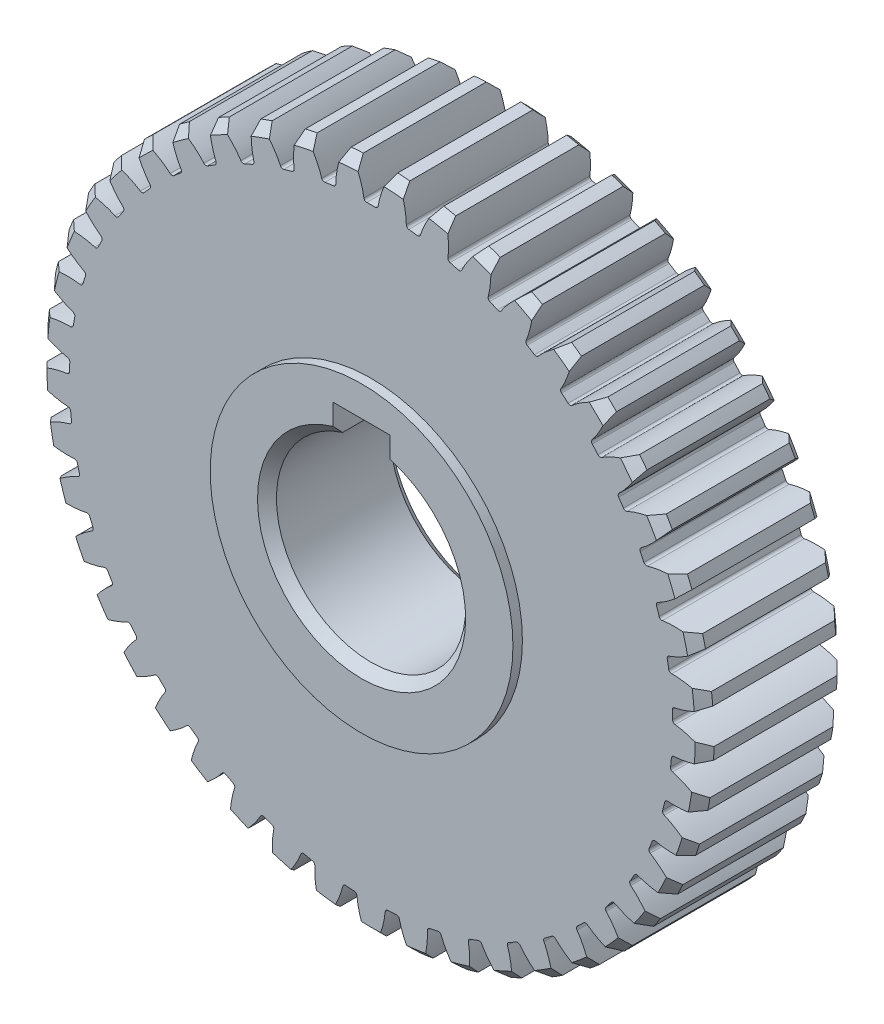
from build123d import *

# Parameters (mm, degrees)
SKETCH_1140_R                    = 35.25
EXTRUDE_1166_DEPTH               = 7.5
CHAMFER_1205_SIZE                = 1
CUT_EXTRUDE_1601_DEPTH           = 7.5
FILLET_1_R                       = 0.3
PATTERN_CIRCULAR_1_COUNT         = 45
FILLET_1_OF_PATTERN_CIRCULAR_1_R = 0.3
SKETCH_1_R                       = 16
EXTRUDE_1_DEPTH                  = 1
CUT_EXTRUDE_1_DEPTH              = 53.352443413
CUT_EXTRUDE_1_DEPTH_BACK         = 2
SKETCH_2_R                       = 20
CUT_EXTRUDE_2_DEPTH              = 52.776233267
CHAMFER_1_SIZE                   = 1


with BuildPart() as part:
    # Sketch 1140 → Extrude 1166 (new, symmetric)
    with BuildSketch(Plane.XY):
        Circle(SKETCH_1140_R)
    extrude(amount=EXTRUDE_1166_DEPTH, both=True)

    # Chamfer 1205
    chamfer_1205_edges = [part.edges().sort_by_distance(p)[0] for p in [
        (-35.25, 0, -7.5),
        (-35.25, 0, 7.5),
    ]]
    chamfer(chamfer_1205_edges, length=CHAMFER_1205_SIZE)

    # Sketch 1286 → Cut-Extrude 1601 (cut, symmetric)
    with BuildSketch(Plane.XY):
        with BuildLine():
            ThreePointArc((-0.720202236, 31.866862628), (0, 31.875), (0.720202236, 31.866862628))
            add(Edge.make_bspline(
                [(0.720202236, 31.866862628), (0.721846783, 31.886965772), (0.729139044, 31.967087408), (0.754197847, 32.166699349), (0.808491142, 32.471975556), (0.900082767, 32.860091396), (1.055369093, 33.394053741), (1.251768326, 33.949265814), (1.470916688, 34.47875715), (1.667406467, 34.899169702), (1.776559915, 35.119972584), (1.818474707, 35.203063073)],
                knots=[0.000932193, 0.000932193, 0.000932193, 0.000932193, 0.000932193, 0.001401017, 0.002802034, 0.005604068, 0.008132613, 0.010661158, 0.015718248, 0.019278665, 0.021441016, 0.021441016, 0.021441016, 0.021441016, 0.021441016], degree=4))
            ThreePointArc((1.818474707, 35.203063073), (0, 35.25), (-1.818474707, 35.203063073))
            add(Edge.make_bspline(
                [(-0.720202236, 31.866862628), (-0.721846783, 31.886965772), (-0.729139044, 31.967087408), (-0.754197847, 32.166699349), (-0.808491142, 32.471975556), (-0.900082767, 32.860091396), (-1.055369093, 33.394053741), (-1.251768326, 33.949265814), (-1.470916688, 34.47875715), (-1.667406467, 34.899169702), (-1.776559915, 35.119972584), (-1.818474707, 35.203063073)],
                knots=[0.000932193, 0.000932193, 0.000932193, 0.000932193, 0.000932193, 0.001401017, 0.002802034, 0.005604068, 0.008132613, 0.010661158, 0.015718248, 0.019278665, 0.021441016, 0.021441016, 0.021441016, 0.021441016, 0.021441016], degree=4))
        make_face()
    cut_extrude_1601 = extrude(amount=CUT_EXTRUDE_1601_DEPTH, both=True, mode=Mode.SUBTRACT)

    # 圆角1
    fillet_1_edges = [part.edges().sort_by_distance(p)[0] for p in [
        (0.720202236, 31.866862628, -3.75),
        (-0.720202236, 31.866862628, -3.75),
    ]]
    fillet(fillet_1_edges, radius=FILLET_1_R)

    # 圆周阵列1: Cut-Extrude 1601 ×45 about axis
    pattern_circular_1_axis = Axis((0, 0, 7.5), (0, 0, -1))
    for i in range(1, PATTERN_CIRCULAR_1_COUNT):
        add(cut_extrude_1601.rotate(pattern_circular_1_axis, i * 360 / PATTERN_CIRCULAR_1_COUNT), mode=Mode.SUBTRACT)

    # 圆角1 of 圆周阵列1
    fillet_1_of_pattern_circular_1_edges = [part.edges().sort_by_distance(p)[0] for p in [
        (5.148203367, 31.456503733, -3.75),
        (3.721816812, 31.65696929, -3.75),
        (9.476000576, 30.433879774, -3.75),
        (8.09139493, 30.830909054, -3.75),
        (13.619358212, 28.818894963, -3.75),
        (12.303483249, 29.404760243, -3.75),
        (17.497630533, 26.642983143, -3.75),
        (16.276098262, 27.406281221, -3.75),
        (21.035331378, 23.948495962, -3.75),
        (19.931917536, 24.87437011, -3.75),
        (24.163603425, 20.787878548, -3.75),
        (23.199784707, 21.858307678, -3.75),
        (26.821558418, 17.222648724, -3.75),
        (26.016094458, 18.416798151, -3.75),
        (28.957462284, 13.322199633, -3.75),
        (28.326030524, 14.616826597, -3.75),
        (30.529742086, 9.162449079, -3.75),
        (30.084632626, 10.532355139, -3.75),
        (31.507795186, 4.824361877, -3.75),
        (31.257671574, 6.242883369, -3.75),
        (31.872584892, 0.392373959, -3.75),
        (31.822315501, 1.831900976, -3.75),
        (31.617010987, -4.047251073, -3.75),
        (31.767574253, -2.614737286, -3.75),
        (30.746047927, -8.408100966, -3.75),
        (31.094513308, -7.010482662, -3.75),
        (29.276648018, -12.605296737, -3.75),
        (29.816233031, -11.269776966, -3.75),
        (27.237411456, -16.557144746, -3.75),
        (27.957613693, -15.309717881, -3.75),
        (24.668029663, -20.186726766, -3.75),
        (25.554831206, -19.051672552, -3.75),
        (21.618512732, -23.423397112, -3.75),
        (22.654652998, -22.422808088, -3.75),
        (18.148216041, -26.204157677, -3.75),
        (19.313527738, -25.35750917, -3.75),
        (14.324684968, -28.474884119, -3.75),
        (15.59648663, -27.79865518, -3.75),
        (10.222340196, -30.191379331, -3.75),
        (11.57587765, -29.698731987, -3.75),
        (5.9210292, -31.320233687, -3.75),
        (7.32995738, -31.020756758, -3.75),
        (1.504472106, -31.83947532, -3.75),
        (2.941367826, -31.738997784, -3.75),
        (-2.941367826, -31.738997784, -3.75),
        (-1.504472106, -31.83947532, -3.75),
        (-7.32995738, -31.020756758, -3.75),
        (-5.9210292, -31.320233687, -3.75),
        (-11.57587765, -29.698731987, -3.75),
        (-10.222340196, -30.191379331, -3.75),
        (-15.59648663, -27.79865518, -3.75),
        (-14.324684968, -28.474884119, -3.75),
        (-19.313527738, -25.35750917, -3.75),
        (-18.148216041, -26.204157677, -3.75),
        (-22.654652998, -22.422808088, -3.75),
        (-21.618512732, -23.423397112, -3.75),
        (-25.554831206, -19.051672552, -3.75),
        (-24.668029663, -20.186726766, -3.75),
        (-27.957613693, -15.309717881, -3.75),
        (-27.237411456, -16.557144746, -3.75),
        (-29.816233031, -11.269776966, -3.75),
        (-29.276648018, -12.605296737, -3.75),
        (-31.094513308, -7.010482662, -3.75),
        (-30.746047927, -8.408100966, -3.75),
        (-31.767574253, -2.614737286, -3.75),
        (-31.617010987, -4.047251073, -3.75),
        (-31.822315501, 1.831900976, -3.75),
        (-31.872584892, 0.392373959, -3.75),
        (-31.257671574, 6.242883369, -3.75),
        (-31.507795186, 4.824361877, -3.75),
        (-30.084632626, 10.532355139, -3.75),
        (-30.529742086, 9.162449079, -3.75),
        (-28.326030524, 14.616826597, -3.75),
        (-28.957462284, 13.322199633, -3.75),
        (-26.016094458, 18.416798151, -3.75),
        (-26.821558418, 17.222648724, -3.75),
        (-23.199784707, 21.858307678, -3.75),
        (-24.163603425, 20.787878548, -3.75),
        (-19.931917536, 24.87437011, -3.75),
        (-21.035331378, 23.948495962, -3.75),
        (-16.276098262, 27.406281221, -3.75),
        (-17.497630533, 26.642983143, -3.75),
        (-12.303483249, 29.404760243, -3.75),
        (-13.619358212, 28.818894963, -3.75),
        (-8.09139493, 30.830909054, -3.75),
        (-9.476000576, 30.433879774, -3.75),
        (-3.721816812, 31.65696929, -3.75),
        (-5.148203367, 31.456503733, -3.75),
    ]]
    fillet(fillet_1_of_pattern_circular_1_edges, radius=FILLET_1_OF_PATTERN_CIRCULAR_1_R)

    # 草图1 → 凸台-拉伸1 (add)
    with BuildSketch(Plane.XY.offset(7.5)):
        Circle(SKETCH_1_R)
    extrude(amount=EXTRUDE_1_DEPTH)

    # 草图2 → 切除-拉伸1 (cut, two sides: drawn at the far end of the back side and taken through both)
    with BuildSketch(Plane(origin=(0, 0, -7.5), x_dir=(-1, 0, 0), z_dir=(0, 0, -1)).offset(-CUT_EXTRUDE_1_DEPTH_BACK)):
        with Locations(Location((0, 0, 0), (0, 0, 180))):
            Circle(SKETCH_2_R)
    extrude(amount=CUT_EXTRUDE_1_DEPTH + CUT_EXTRUDE_1_DEPTH_BACK, mode=Mode.SUBTRACT)

    # 草图3 → 切除-拉伸2 (cut, through all)
    with BuildSketch(Plane(origin=(0, 0, -5.5), x_dir=(-1, 0, 0), z_dir=(0, 0, -1))):
        with BuildLine():
            Line((-3, 9.539392014), (-3, 12.8))
            Line((-3, 12.8), (3, 12.8))
            Line((3, 12.8), (3, 9.539392014))
            ThreePointArc((3, 9.539392014), (0, -10), (-3, 9.539392014))
        make_face()
    extrude(amount=-CUT_EXTRUDE_2_DEPTH, mode=Mode.SUBTRACT)

    # 倒角1
    chamfer_1_edges = [part.edges().sort_by_distance(p)[0] for p in [
        (0, -10, 8.5),
        (0, -10, -5.5),
    ]]
    chamfer(chamfer_1_edges, length=CHAMFER_1_SIZE)


solid = part.part
